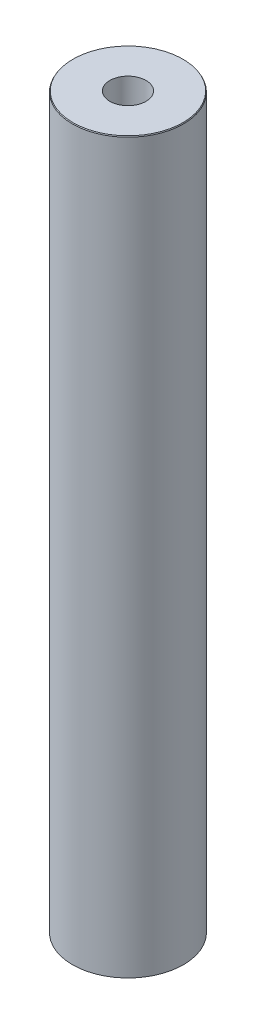
from build123d import *
from OCP.BRepFilletAPI import BRepFilletAPI_MakeChamfer

# Parameters (mm, degrees)
SKETCH1_R           = 30
BOSS_EXTRUDE1_DEPTH = 394.291483445
SKETCH2_R           = 9.786757892
CUT_EXTRUDE1_DEPTH  = 397.567489738
CHAMFER1_SIZE       = 0.486004369
CHAMFER1_SIZE2      = 0.280594753


with BuildPart() as part:
    # Sketch1 → Boss-Extrude1 (new body)
    with BuildSketch(Plane(origin=(0, 0, 0), x_dir=(1, 0, 0), z_dir=(0, 1, 0))):
        Circle(SKETCH1_R)
    extrude(amount=BOSS_EXTRUDE1_DEPTH)

    # Sketch2 → Cut-Extrude1 (cut, through all)
    with BuildSketch(Plane(origin=(0, 0, 0), x_dir=(1, 0, 0), z_dir=(0, 1, 0))):
        Circle(SKETCH2_R)
    extrude(amount=CUT_EXTRUDE1_DEPTH, mode=Mode.SUBTRACT)

    # Chamfer1: one chamfer whose edges measure the first distance from different faces: ONE call of the kernel's chamfer builder (chamfer() names one face for all edges)
    chamfer1_edges_1 = [part.edges().sort_by_distance(p)[0] for p in [
        (-30, 394.291483445, 0),
    ]]
    chamfer1_side_1 = [part.faces().sort_by_distance(p)[0] for p in [
        (-30, 197.145741723, 0),
    ]]
    chamfer1_edges_2 = [part.edges().sort_by_distance(p)[0] for p in [
        (-30, 0, 0),
    ]]
    chamfer1_side_2 = [part.faces().sort_by_distance(p)[0] for p in [
        (-29.151471863, 0, 0),
    ]]
    chamfer1 = BRepFilletAPI_MakeChamfer(part.part.solid().wrapped)
    for e in chamfer1_edges_1:
        chamfer1.Add(CHAMFER1_SIZE, CHAMFER1_SIZE2, e.wrapped, chamfer1_side_1[0].wrapped)  # the first distance lies on this face
    for e in chamfer1_edges_2:
        chamfer1.Add(CHAMFER1_SIZE, CHAMFER1_SIZE2, e.wrapped, chamfer1_side_2[0].wrapped)  # the first distance lies on this face
    add(Compound.cast(chamfer1.Shape()), mode=Mode.REPLACE)


solid = part.part
